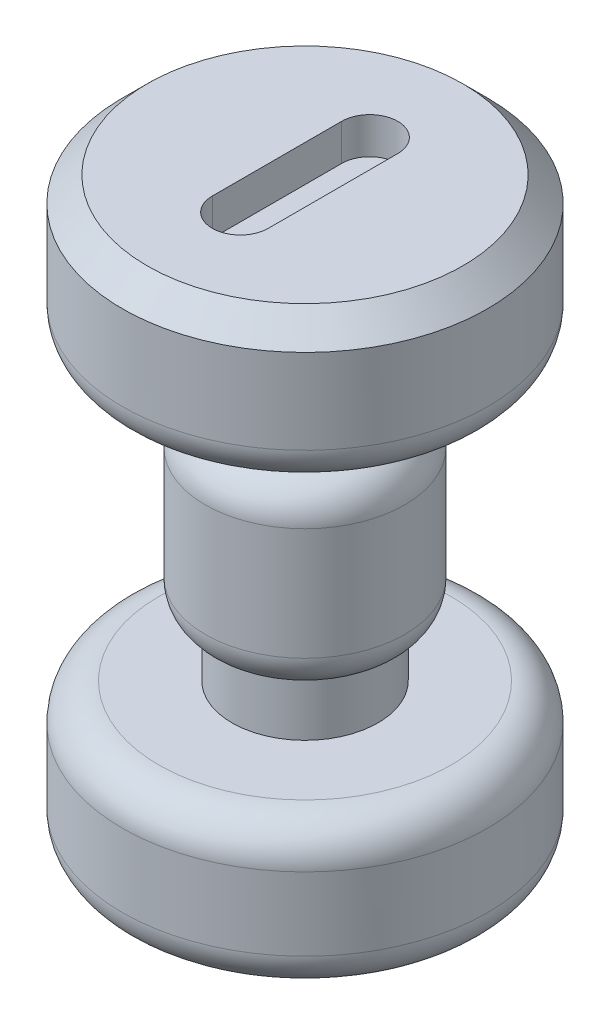
from build123d import *

# Parameters (mm, degrees)
SKETCH_3_R          = 13.661879352
EXTRUDE_1_DEPTH     = 12.5
CUT_EXTRUDE_1_DEPTH = 5
FILLET_1_R          = 5


with BuildPart() as part:
    # 草图2 → 旋转1 (revolve)
    with BuildSketch(Plane.XY):
        Polygon((0, 0), (-25, 0), (-25, 20), (-10, 20), (-10, 60), (-25, 60), (-25, 80), (0, 80), align=None)
    revolve(axis=Axis((0, 80, 0), (0, -1, 0)))

    # 草图3 → 凸台-拉伸1 (add, symmetric)
    with BuildSketch(Plane(origin=(0, 40, 0), x_dir=(1, 0, 0), z_dir=(0, 1, 0))):
        with Locations(Location((0, 0, 0), (0, 0, 180))):
            Circle(SKETCH_3_R)
    extrude(amount=EXTRUDE_1_DEPTH, both=True)

    # 草图4 → 切除-拉伸1 (cut)
    with BuildSketch(Plane(origin=(0, 80, 0), x_dir=(1, 0, 0), z_dir=(0, 1, 0))):
        with BuildLine():
            Line((-3.834152171, -8.865208988), (-3.834152171, 8.865208988))
            ThreePointArc((-3.834152171, 8.865208988), (0, 12.699361159), (3.834152171, 8.865208988))
            Line((3.834152171, 8.865208988), (3.834152171, -8.865208988))
            ThreePointArc((3.834152171, -8.865208988), (0, -12.699361159), (-3.834152171, -8.865208988))
        make_face()
    extrude(amount=-CUT_EXTRUDE_1_DEPTH, mode=Mode.SUBTRACT)

    # 草图5 → 切除-旋转1 (revolve, cut)
    with BuildSketch(Plane(origin=(0, 0, 0), x_dir=(0, 0, -1), z_dir=(1, 0, 0)), mode=Mode.PRIVATE) as cut_revolve_1_sk:
        Polygon((-25, 80), (-25, 76.608006346), (-21.608006346, 80), align=None)
    revolve(cut_revolve_1_sk.sketch.rotate(Axis((0, 0, 0), (0, 1, 0)), 270), axis=Axis((0, 0, 0), (0, 1, 0)), mode=Mode.SUBTRACT)

    # 圆角1
    # the kernel refuses this fillet: 5 mm, written as the material it takes off along each edge
    with BuildSketch(Plane(origin=(0, 27.5, 0), x_dir=(-1, 0, 0), z_dir=(0, 0, -1))) as fillet_1_piece_1:
        with BuildLine():
            CenterArc((8.661879352, 4.817616956), FILLET_1_R, 285.5229375, 74.4770625)
            Line((13.661879352, 4.817616956), (13.761879352, 4.817616956))
            Line((13.761879352, 4.817616956), (13.761879352, 0))
            Line((13.761879352, 0), (13.661879352, -0.1))
            ThreePointArc((13.661879352, -0.1), (11.830939676, -0.1), (10.026762413, -0.096352339))
            Line((10.026762413, -0.096352339), (10, 0))
        make_face()
    revolve(axis=Axis((0, 27.5, 0), (0, 1, 0)), mode=Mode.SUBTRACT)
    with BuildSketch(Plane(origin=(0, 52.5, 0), x_dir=(-1, 0, 0), z_dir=(0, 0, -1))) as fillet_1_piece_2:
        with BuildLine():
            CenterArc((8.661879352, -4.817616956), FILLET_1_R, 0, 74.4770625)
            Line((10, 0), (10.026762413, 0.096352339))
            ThreePointArc((10.026762413, 0.096352339), (11.830939676, 0.1), (13.661879352, 0.1))
            Line((13.661879352, 0.1), (13.761879352, 0))
            Line((13.761879352, 0), (13.761879352, -4.817616956))
            Line((13.761879352, -4.817616956), (13.661879352, -4.817616956))
        make_face()
    revolve(axis=Axis((0, 52.5, 0), (0, 1, 0)), mode=Mode.SUBTRACT)
    with BuildSketch(Plane(origin=(0, 60, 0), x_dir=(-1, 0, 0), z_dir=(0, 0, 1))) as fillet_1_piece_3:
        with BuildLine():
            CenterArc((25 - FILLET_1_R, -FILLET_1_R), FILLET_1_R, 0, 90)
            Line((25, -FILLET_1_R), (25 + FILLET_1_R * 0.02, -FILLET_1_R))
            Line((25 + FILLET_1_R * 0.02, -FILLET_1_R), (25 + FILLET_1_R * 0.02, FILLET_1_R * 0.02))
            Line((25 + FILLET_1_R * 0.02, FILLET_1_R * 0.02), (25 - FILLET_1_R, FILLET_1_R * 0.02))
            Line((25 - FILLET_1_R, FILLET_1_R * 0.02), (25 - FILLET_1_R, 0))
        make_face()
    revolve(axis=Axis((0, 60, 0), (0, -1, 0)), mode=Mode.SUBTRACT)
    with BuildSketch(Plane(origin=(0, 20, 0), x_dir=(-1, 0, 0), z_dir=(0, 0, 1))) as fillet_1_piece_4:
        with BuildLine():
            CenterArc((25 - FILLET_1_R, FILLET_1_R), FILLET_1_R, 270, 90)
            Line((25 - FILLET_1_R, 0), (25 - FILLET_1_R, -FILLET_1_R * 0.02))
            Line((25 - FILLET_1_R, -FILLET_1_R * 0.02), (25 + FILLET_1_R * 0.02, -FILLET_1_R * 0.02))
            Line((25 + FILLET_1_R * 0.02, -FILLET_1_R * 0.02), (25 + FILLET_1_R * 0.02, FILLET_1_R))
            Line((25 + FILLET_1_R * 0.02, FILLET_1_R), (25, FILLET_1_R))
        make_face()
    revolve(axis=Axis((0, 20, 0), (0, -1, 0)), mode=Mode.SUBTRACT)
    with BuildSketch(Plane(origin=(0, 0, 0), x_dir=(-1, 0, 0), z_dir=(0, 0, 1))) as fillet_1_piece_5:
        with BuildLine():
            CenterArc((25 - FILLET_1_R, -FILLET_1_R), FILLET_1_R, 0, 90)
            Line((25, -FILLET_1_R), (25 + FILLET_1_R * 0.02, -FILLET_1_R))
            Line((25 + FILLET_1_R * 0.02, -FILLET_1_R), (25 + FILLET_1_R * 0.02, FILLET_1_R * 0.02))
            Line((25 + FILLET_1_R * 0.02, FILLET_1_R * 0.02), (25 - FILLET_1_R, FILLET_1_R * 0.02))
            Line((25 - FILLET_1_R, FILLET_1_R * 0.02), (25 - FILLET_1_R, 0))
        make_face()
    revolve(axis=Axis((0, 0, 0), (0, -1, 0)), mode=Mode.SUBTRACT)


solid = part.part
